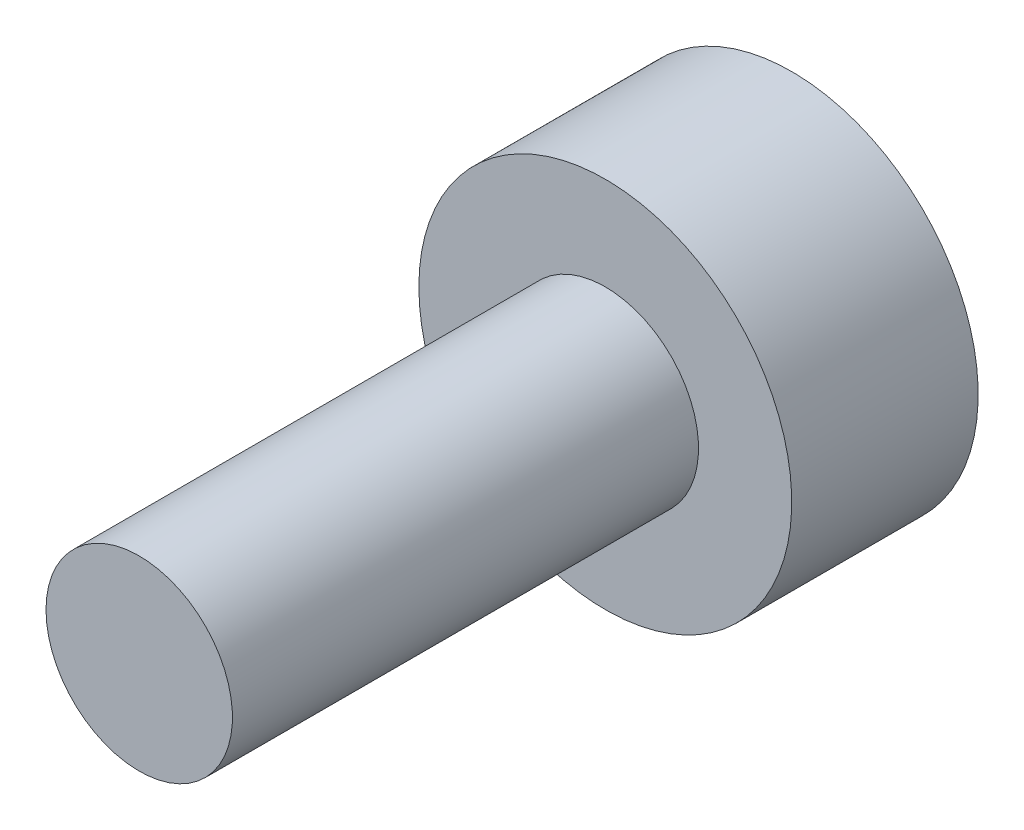
from build123d import *

# Parameters (mm, degrees)
CUT_EXTRUDE1_DEPTH = 1.2


with BuildPart() as part:
    # Sketch1 → Revolve1 (revolve)
    with BuildSketch(Plane(origin=(0, 0, 0), x_dir=(1, 0, 0), z_dir=(0, 1, 0))):
        Polygon((0, 0), (1, 0), (1, 5), (2, 5), (2, 7), (0, 7), align=None)
    revolve(axis=Axis((0, 0, -7), (0, 0, 1)))

    # Sketch2 → Cut-Extrude1 (cut)
    with BuildSketch(Plane(origin=(0, 0, -7), x_dir=(-1, 0, 0), z_dir=(0, 0, -1))):
        Polygon((0.433012702, 0.75), (-0.433012702, 0.75), (-0.866025404, 0), (-0.433012702, -0.75), (0.433012702, -0.75), (0.866025404, 0), align=None)
    extrude(amount=-CUT_EXTRUDE1_DEPTH, mode=Mode.SUBTRACT)


solid = part.part
